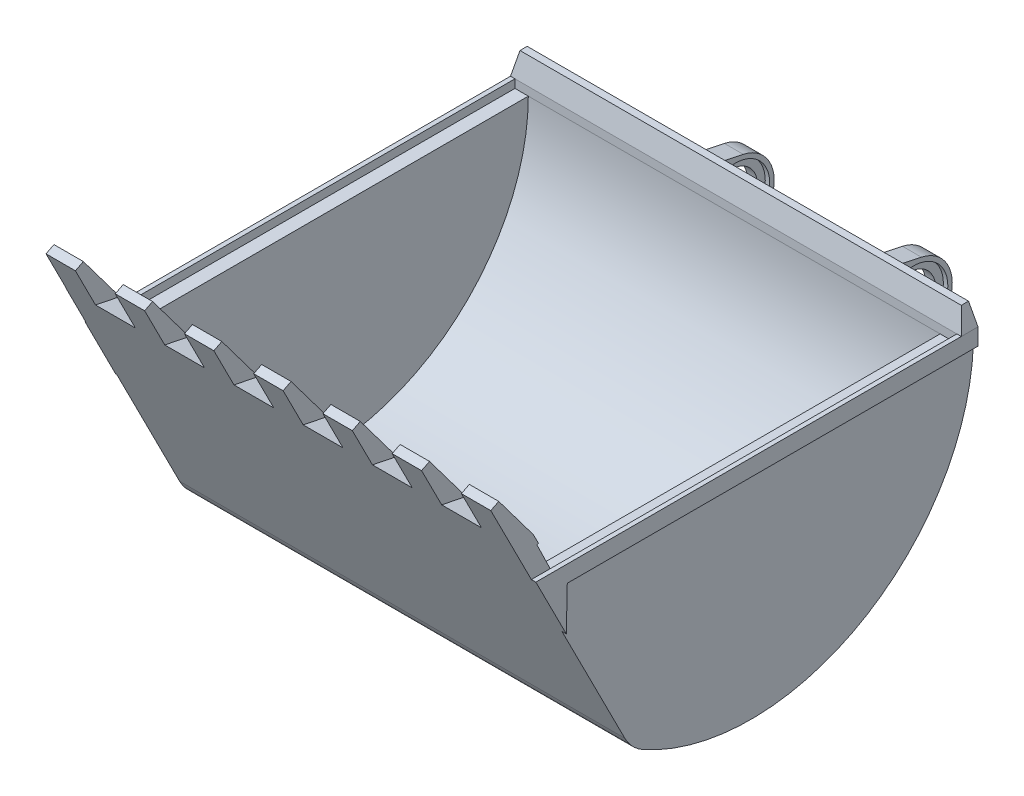
from build123d import *
from OCP.BRepFilletAPI import BRepFilletAPI_MakeChamfer

# Parameters (mm, degrees)
SKETCH1_R                    = 20
BOSS_EXTRUDE1_DEPTH          = 40
WRAP6_SECTION_W              = 2
WRAP6_SECTION_H              = 40
WRAP6_ANGLE                  = 68.754935416
CUT_EXTRUDE3_DEPTH           = 40
CUT_EXTRUDE4_DEPTH           = 40
SHELL1_START                 = -38.5
SHELL1_DEPTH                 = 37
BOSS_EXTRUDE6_DEPTH          = 1.7
CHAMFER3_SIZE2               = 5.104153638
CHAMFER3_SIZE                = 0.9
LPATTERN3_COUNT              = 7
LPATTERN3_PITCH              = 6.22
CHAMFER3_OF_LPATTERN3_SIZE   = 0.9
CHAMFER3_OF_LPATTERN3_SIZE_2 = 5.104153638
BOSS_EXTRUDE9_DEPTH          = 1.7
BOSS_EXTRUDE10_DEPTH         = 1.7
BOSS_EXTRUDE11_REACH         = 61.927
BOSS_EXTRUDE11_END_RADIUS    = 20
SKETCH26_W                   = 1.7
SKETCH26_H                   = 8.060132267
BOSS_EXTRUDE12_REACH         = 61.482
BOSS_EXTRUDE12_END_RADIUS    = 20
SKETCH31_W                   = 1.7
SKETCH31_H                   = 8.563925154
SKETCH35_R                   = 2.4
CUT_EXTRUDE5_DEPTH           = 46.6949855
SKETCH36_R                   = 3.1
CUT_EXTRUDE6_DEPTH           = 0.4
CUT_EXTRUDE7_START           = -0.4
SKETCH37_R                   = 3.1
CUT_EXTRUDE7_DEPTH           = 0.4
LPATTERN4_COUNT              = 2
LPATTERN4_PITCH              = 16
FILLET1_R                    = 4
BOSS_EXTRUDE13_DEPTH         = 0.4
LPATTERN5_COUNT              = 2
LPATTERN5_PITCH              = 40.1
SKETCH39_W                   = 40.5
SKETCH39_H                   = 1.5
BOSS_EXTRUDE14_DEPTH         = 1.5
SKETCH40_W                   = 40.5
SKETCH40_H                   = 1.5
BOSS_EXTRUDE15_DEPTH         = 2
BOSS_EXTRUDE15_TAPER         = 12


# Read off the part's stored shape, not the designer's step: Shell1
with BuildPart() as part:
    # Sketch1 → Boss-Extrude1 (new body)
    with BuildSketch(Plane(origin=(0, 0, 0), x_dir=(0, 0, -1), z_dir=(1, 0, 0))):
        Circle(SKETCH1_R)
    extrude(amount=-BOSS_EXTRUDE1_DEPTH)

    # Wrap6 section (on wrap section) → Wrap6 (revolve)
    with BuildSketch(Plane(origin=(0, 0, 0), x_dir=(0, 0.19866933079506122, 0.9800665778412416), z_dir=(0, 0.9800665778412416, -0.19866933079506122))):
        with Locations((21, -20)):
            Rectangle(WRAP6_SECTION_W, WRAP6_SECTION_H)
    revolve(axis=Axis((0, 0, 0), (1, 0, 0)), revolution_arc=WRAP6_ANGLE)

    # Sketch7 → Cut-Extrude3 (cut)
    with BuildSketch(Plane(origin=(0, 0, 0), x_dir=(0, 0, -1), z_dir=(1, 0, 0))):
        Polygon((-21.561464713, 4.370725277), (-10.806046117, -16.829419696), (-13.2224557, -32.299256077), (-33.361013034, 4.370725277), align=None)
    extrude(amount=-CUT_EXTRUDE3_DEPTH, mode=Mode.SUBTRACT)

    # Sketch8 → Cut-Extrude4 (cut)
    with BuildSketch(Plane(origin=(0, 0, 0), x_dir=(0, 0, -1), z_dir=(1, 0, 0))):
        with BuildLine():
            Line((-19.601331557, 3.973386616), (-17.669228411, 0))
            Line((-17.669228411, 0), (20, 0))
            ThreePointArc((20, 0), (1.996668333, 19.900083306), (-19.601331557, 3.973386616))
        make_face()
    extrude(amount=-CUT_EXTRUDE4_DEPTH, mode=Mode.SUBTRACT)

    # Shell1 outline → Shell1 (cut)
    with BuildSketch(Plane.YZ.offset(SHELL1_START)):
        with BuildLine():
            Line((0, 17.662079948), (-15.779750214, 9.656577198))
            ThreePointArc((-15.779750214, 9.656577198), (-16.138411913, -9.044427064), (0, -18.5))
            Line((0, -18.5), (0, 17.662079948))
        make_face()
    extrude(amount=SHELL1_DEPTH, mode=Mode.SUBTRACT)

    # Sketch17 → Boss-Extrude6 (add)
    with BuildSketch(Plane(origin=(0, -7.804938117, 15.384414667), x_dir=(1, 0, 0), z_dir=(0, -0.4524337453692514, 0.8917980186405168))):
        Polygon((-2.641259026, 11.553646958), (0, 11.553646958), (0, 13.652938378), (0, 17.652938378), (-2.641259026, 17.652938378), align=None)
    boss_extrude6 = extrude(amount=-BOSS_EXTRUDE6_DEPTH)

    # Chamfer3
    chamfer3_edges = [part.edges().sort_by_distance(p)[0] for p in [
        (-1.320629513, 8.707054719, 21.855143062),
    ]]
    chamfer3_side = [part.faces().sort_by_distance(p)[0] for p in [
        (-1.320629513, 8.698910912, 21.871195427),
    ]]
    chamfer(chamfer3_edges, length=CHAMFER3_SIZE - 0.0001, length2=CHAMFER3_SIZE2 - 0.0001, reference=chamfer3_side[0])  # a hair under: the kernel refuses the full size

    # LPattern3: Boss-Extrude6 ×7
    with Locations(*[(-i * LPATTERN3_PITCH, 0, 0) for i in range(1, LPATTERN3_COUNT)]):
        add(boss_extrude6)

    # Chamfer3 of LPattern3
    chamfer3_of_lpattern3_edges_1 = [part.edges().sort_by_distance(p)[0] for p in [
        (-7.540629513, 8.707054719, 21.855143062),
    ]]
    chamfer3_of_lpattern3_side_1 = [part.faces().sort_by_distance(p)[0] for p in [
        (-7.540629513, 8.698910912, 21.871195427),
    ]]
    chamfer3_of_lpattern3_edges_2 = [part.edges().sort_by_distance(p)[0] for p in [
        (-13.760629513, 8.707054719, 21.855143062),
    ]]
    chamfer3_of_lpattern3_side_2 = [part.faces().sort_by_distance(p)[0] for p in [
        (-13.760629513, 8.698910912, 21.871195427),
    ]]
    chamfer3_of_lpattern3_edges_3 = [part.edges().sort_by_distance(p)[0] for p in [
        (-19.980629513, 8.707054719, 21.855143062),
    ]]
    chamfer3_of_lpattern3_side_3 = [part.faces().sort_by_distance(p)[0] for p in [
        (-19.980629513, 8.698910912, 21.871195427),
    ]]
    chamfer3_of_lpattern3_edges_4 = [part.edges().sort_by_distance(p)[0] for p in [
        (-26.200629513, 8.707054719, 21.855143062),
    ]]
    chamfer3_of_lpattern3_side_4 = [part.faces().sort_by_distance(p)[0] for p in [
        (-26.200629513, 8.698910912, 21.871195427),
    ]]
    chamfer3_of_lpattern3_edges_5 = [part.edges().sort_by_distance(p)[0] for p in [
        (-32.420629513, 8.707054719, 21.855143062),
    ]]
    chamfer3_of_lpattern3_side_5 = [part.faces().sort_by_distance(p)[0] for p in [
        (-32.420629513, 8.698910912, 21.871195427),
    ]]
    chamfer3_of_lpattern3_edges_6 = [part.edges().sort_by_distance(p)[0] for p in [
        (-38.640629513, 8.707054719, 21.855143062),
    ]]
    chamfer3_of_lpattern3_side_6 = [part.faces().sort_by_distance(p)[0] for p in [
        (-38.640629513, 8.691002355, 21.846999255),
    ]]
    chamfer3_of_lpattern3 = BRepFilletAPI_MakeChamfer(part.part.solid().wrapped)
    for e in chamfer3_of_lpattern3_edges_1:
        chamfer3_of_lpattern3.Add(CHAMFER3_OF_LPATTERN3_SIZE - 0.0001, CHAMFER3_OF_LPATTERN3_SIZE_2 - 0.0001, e.wrapped, chamfer3_of_lpattern3_side_1[0].wrapped)
    for e in chamfer3_of_lpattern3_edges_2:
        chamfer3_of_lpattern3.Add(CHAMFER3_OF_LPATTERN3_SIZE - 0.0001, CHAMFER3_OF_LPATTERN3_SIZE_2 - 0.0001, e.wrapped, chamfer3_of_lpattern3_side_2[0].wrapped)
    for e in chamfer3_of_lpattern3_edges_3:
        chamfer3_of_lpattern3.Add(CHAMFER3_OF_LPATTERN3_SIZE - 0.0001, CHAMFER3_OF_LPATTERN3_SIZE_2 - 0.0001, e.wrapped, chamfer3_of_lpattern3_side_3[0].wrapped)
    for e in chamfer3_of_lpattern3_edges_4:
        chamfer3_of_lpattern3.Add(CHAMFER3_OF_LPATTERN3_SIZE - 0.0001, CHAMFER3_OF_LPATTERN3_SIZE_2 - 0.0001, e.wrapped, chamfer3_of_lpattern3_side_4[0].wrapped)
    for e in chamfer3_of_lpattern3_edges_5:
        chamfer3_of_lpattern3.Add(CHAMFER3_OF_LPATTERN3_SIZE - 0.0001, CHAMFER3_OF_LPATTERN3_SIZE_2 - 0.0001, e.wrapped, chamfer3_of_lpattern3_side_5[0].wrapped)
    for e in chamfer3_of_lpattern3_edges_6:
        chamfer3_of_lpattern3.Add(CHAMFER3_OF_LPATTERN3_SIZE_2 - 0.0001, CHAMFER3_OF_LPATTERN3_SIZE - 0.0001, e.wrapped, chamfer3_of_lpattern3_side_6[0].wrapped)
    add(Compound.cast(chamfer3_of_lpattern3.Shape()), mode=Mode.REPLACE)  # a hair under: the kernel refuses the full size



with BuildPart() as body_2:
    # Sketch18 → Boss-Extrude9 (new body)
    with BuildSketch(Plane(origin=(-12, 9.40212228, -3.028508389), x_dir=(0, -0.20791169081773309, -0.9781476007338114), z_dir=(1, 0, 0))):
        with BuildLine():
            Line((24.462887784, -6.44514078), (19.462887784, -6.44514078))
            Line((19.462887784, -6.44514078), (18.368989474, -14.430697657))
            Line((18.368989474, -14.430697657), (24.462887784, -13.44514078))
            ThreePointArc((24.462887784, -13.44514078), (27.962887784, -9.94514078), (24.462887784, -6.44514078))
        make_face()
    boss_extrude9 = extrude(amount=BOSS_EXTRUDE9_DEPTH)


with BuildPart() as body_3:
    # Sketch23 → Boss-Extrude10 (new body)
    with BuildSketch(Plane(origin=(-12, 6.645607303, -3.623209558), x_dir=(0, -0.3420201433256566, -0.9396926207859128), z_dir=(1, 0, 0))):
        with BuildLine():
            Line((23.775411733, -9.543929755), (18.775411733, -9.543929755))
            Line((18.775411733, -9.543929755), (16.378556498, -17.765602275))
            Line((16.378556498, -17.765602275), (23.775411733, -16.543929755))
            ThreePointArc((23.775411733, -16.543929755), (27.275411733, -13.043929755), (23.775411733, -9.543929755))
        make_face()
    boss_extrude10 = extrude(amount=BOSS_EXTRUDE10_DEPTH)


with BuildPart() as part_1:
    add(part.part)

    add(body_2.part)  # Boss-Extrude11 merges body 2
    # Boss-Extrude11: up to this cylinder (the profile starts outside it)
    boss_extrude11_end = Plane(origin=(-11.15, 0, 0), z_dir=(1, 0, 0)) * Cylinder(BOSS_EXTRUDE11_END_RADIUS, 164.854, mode=Mode.PRIVATE)
    # Sketch26 → Boss-Extrude11 (add, up to the surface)
    with BuildSketch(Plane(origin=(0, -6.71453374, -18.65024081), x_dir=(1, 0, 0), z_dir=(0, 0.3387394336586716, 0.9408802240905069)), mode=Mode.PRIVATE) as boss_extrude11_sk1:
        with Locations((-11.15, 2.098020073)):
            Rectangle(SKETCH26_W, SKETCH26_H)
    boss_extrude11_tool1 = extrude(boss_extrude11_sk1.sketch, amount=BOSS_EXTRUDE11_REACH, mode=Mode.PRIVATE) - boss_extrude11_end
    boss_extrude11 = boss_extrude11_tool1.solids().sort_by_distance((-11.15, -4.740548, -19.360923))[0]
    add(boss_extrude11)


    add(body_3.part)  # Boss-Extrude12 merges body 3
    # Boss-Extrude12: up to this cylinder (the profile starts outside it)
    boss_extrude12_end = Plane(origin=(-11.15, 0, 0), z_dir=(1, 0, 0)) * Cylinder(BOSS_EXTRUDE12_END_RADIUS, 163.964, mode=Mode.PRIVATE)
    # Sketch31 → Boss-Extrude12 (add, up to the surface)
    with BuildSketch(Plane(origin=(0, -11.64258856, -15.876784348), x_dir=(-1, 0, 0), z_dir=(0, -0.5913508934195582, -0.8064143605193862)), mode=Mode.PRIVATE) as boss_extrude12_sk1:
        with Locations((11.15, -0.687946115)):
            Rectangle(SKETCH31_W, SKETCH31_H)
    boss_extrude12_tool1 = extrude(boss_extrude12_sk1.sketch, amount=-BOSS_EXTRUDE12_REACH, mode=Mode.PRIVATE) - boss_extrude12_end
    boss_extrude12 = boss_extrude12_tool1.solids().sort_by_distance((-11.15, -12.197358, -15.469967))[0] + boss_extrude12_tool1.solids().sort_by_distance((-11.15, -12.197358, -15.469967))[1]
    add(boss_extrude12)

    # Sketch35 → Cut-Extrude5 (cut, through all)
    with BuildSketch(Plane(origin=(-10.3, 0, 0), x_dir=(0, 0, -1), z_dir=(1, 0, 0))):
        with Locations((24.889112346, -5.411813674)):
            Circle(SKETCH35_R)
        with Locations((21.503501796, -13.743346963)):
            Circle(SKETCH35_R)
    cut_extrude5 = extrude(amount=-CUT_EXTRUDE5_DEPTH, mode=Mode.SUBTRACT)

    # Sketch36 → Cut-Extrude6 (cut)
    with BuildSketch(Plane(origin=(-10.3, 0, 0), x_dir=(0, 0, -1), z_dir=(1, 0, 0))):
        with Locations((24.889112346, -5.411813674)):
            Circle(SKETCH36_R)
        with Locations((21.503501796, -13.743346963)):
            Circle(SKETCH36_R)
    cut_extrude6 = extrude(amount=-CUT_EXTRUDE6_DEPTH, mode=Mode.SUBTRACT)

    # Sketch37 → Cut-Extrude7 (cut)
    with BuildSketch(Plane.ZY.offset(12).offset(CUT_EXTRUDE7_START)):
        with Locations(Location((-24.889112346, -5.411813674, 0), (0, 0, 180))):
            Circle(SKETCH37_R)
        with Locations(Location((-21.503501796, -13.743346963, 0), (0, 0, 180))):
            Circle(SKETCH37_R)
    cut_extrude7 = extrude(amount=CUT_EXTRUDE7_DEPTH, mode=Mode.SUBTRACT)

    # LPattern4: Boss-Extrude9, Boss-Extrude10, Boss-Extrude11, Boss-Extrude12, Cut-Extrude5, Cut-Extrude6, Cut-Extrude7 ×2
    with Locations(*[(-i * LPATTERN4_PITCH, 0, 0) for i in range(1, LPATTERN4_COUNT)]):
        add(boss_extrude9)
        add(boss_extrude10)
        add(boss_extrude11)
        add(boss_extrude12)
        add(cut_extrude5, mode=Mode.SUBTRACT)
        add(cut_extrude6, mode=Mode.SUBTRACT)
        add(cut_extrude7, mode=Mode.SUBTRACT)

    # Fillet1
    fillet1_edges = [part_1.edges().sort_by_distance(p)[0] for p in [
        (-20, -16.829419696, 10.806046117),
    ]]
    fillet(fillet1_edges, radius=FILLET1_R)

    # Sketch38 → Boss-Extrude13 (add)
    with BuildSketch(Plane(origin=(0, 0, 0), x_dir=(0, 0, -1), z_dir=(1, 0, 0))):
        Polygon((-19.72457086, 0.75), (20, 0.75), (20, -0.75), (-16.900694448, -0.75), (-16.986407143, -4.647229987), align=None)
    boss_extrude13 = extrude(amount=BOSS_EXTRUDE13_DEPTH)

    # LPattern5: Boss-Extrude13 ×2
    with Locations(*[(-i * LPATTERN5_PITCH, 0, 0) for i in range(1, LPATTERN5_COUNT)]):
        add(boss_extrude13)

    # Sketch39 → Boss-Extrude14 (add)
    with BuildSketch(Plane(origin=(0, 0, -20), x_dir=(-1, 0, 0), z_dir=(0, 0, -1))):
        with Locations((19.85, 0)):
            Rectangle(SKETCH39_W, SKETCH39_H)
    extrude(amount=-BOSS_EXTRUDE14_DEPTH)

    # Sketch40 → Boss-Extrude15 (add)
    with BuildSketch(Plane(origin=(0, 0.75, 0), x_dir=(1, 0, 0), z_dir=(0, 1, 0))):
        with Locations((-19.85, 19.25)):
            Rectangle(SKETCH40_W, SKETCH40_H)
    extrude(amount=BOSS_EXTRUDE15_DEPTH, taper=BOSS_EXTRUDE15_TAPER)


solid = part_1.part
